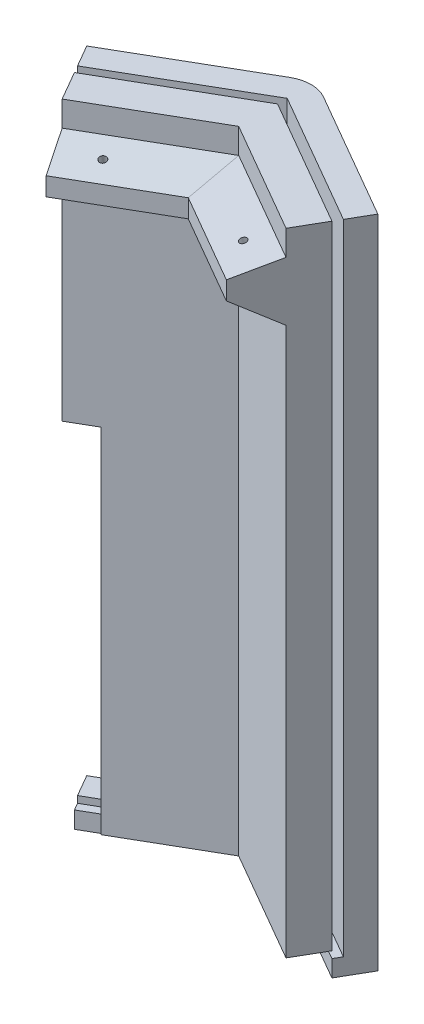
from build123d import *

# Parameters (mm, degrees)
BOSS_EXTRUDE1_DEPTH = 390
CUT_EXTRUDE2_DEPTH  = 14
CUT_EXTRUDE3_DEPTH  = 50
BOSS_EXTRUDE2_DEPTH = 10
BOSS_EXTRUDE3_REACH = 473.852
BOSS_EXTRUDE4_REACH = 479.913
SKETCH22_R          = 2.1
CUT_EXTRUDE4_DEPTH  = 15
SKETCH23_R          = 3.1
CUT_EXTRUDE5_DEPTH  = 60
SKETCH24_W          = 17
SKETCH24_H          = 210
CUT_EXTRUDE6_DEPTH  = 414.617211129


with BuildPart() as part:
    # Sketch1 → Boss-Extrude1 (new body)
    with BuildSketch(Plane(origin=(0, 0, 0), x_dir=(1, 0, 0), z_dir=(0, 1, 0))):
        with BuildLine():
            Line((-10, -5.773502692), (-86.602540378, -50))
            Line((-86.602540378, -50), (-79.102540378, -62.990381057))
            Line((-79.102540378, -62.990381057), (-53.121778265, -47.990381057))
            Line((-53.121778265, -47.990381057), (-50.621778265, -52.320508076))
            Line((-50.621778265, -52.320508076), (-76.602540378, -67.320508076))
            Line((-76.602540378, -67.320508076), (-66.602540378, -84.641016151))
            Line((-66.602540378, -84.641016151), (0, -46.188021535))
            Line((0, -46.188021535), (66.602540378, -84.641016151))
            Line((66.602540378, -84.641016151), (76.602540378, -67.320508076))
            Line((76.602540378, -67.320508076), (50.621778265, -52.320508076))
            Line((50.621778265, -52.320508076), (53.121778265, -47.990381057))
            Line((53.121778265, -47.990381057), (79.102540378, -62.990381057))
            Line((79.102540378, -62.990381057), (86.602540378, -50))
            Line((86.602540378, -50), (10, -5.773502692))
            ThreePointArc((10, -5.773502692), (0, -3.094010768), (-10, -5.773502692))
        make_face()
    extrude(amount=BOSS_EXTRUDE1_DEPTH)

    # Sketch18 → Cut-Extrude2 (cut)
    with BuildSketch(Plane.XZ):
        Polygon((-76.602540378, 67.320508076), (0, 23.094010768), (76.602540378, 67.320508076), (66.602540378, 84.641016151), (0, 46.188021535), (-66.602540378, 84.641016151), align=None)
    extrude(amount=-CUT_EXTRUDE2_DEPTH, mode=Mode.SUBTRACT)

    # Sketch19 → Cut-Extrude3 (cut)
    with BuildSketch(Plane(origin=(0, 390, 0), x_dir=(1, 0, 0), z_dir=(0, 1, 0))):
        Polygon((76.602540378, -67.320508076), (0, -23.094010768), (-76.602540378, -67.320508076), (-79.102540378, -62.990381057), (0, -17.320508076), (79.102540378, -62.990381057), align=None)
    extrude(amount=-CUT_EXTRUDE3_DEPTH, mode=Mode.SUBTRACT)

    # Sketch20 → Boss-Extrude2 (add)
    with BuildSketch(Plane.XZ):
        Polygon((76.602540378, 67.320508076), (50.621778265, 52.320508076), (53.121778265, 47.990381057), (79.102540378, 62.990381057), align=None)
        Polygon((-50.621778265, 52.320508076), (-76.602540378, 67.320508076), (-79.102540378, 62.990381057), (-53.121778265, 47.990381057), align=None)
    extrude(amount=-BOSS_EXTRUDE2_DEPTH)

    # Boss-Extrude3: up to this plane
    boss_extrude3_end = Plane(origin=(-86.602540378, 390, 50), z_dir=(0.8660254037844359, 0, -0.5000000000000048))
    # Sketch21 → Boss-Extrude3 (add, up to the surface)
    with BuildSketch(Plane(origin=(0, 0, 0), x_dir=(0, 0, -1), z_dir=(1, 0, 0)), mode=Mode.PRIVATE) as boss_extrude3_sk1:
        Polygon((-46.188021535, 375), (-76.188021535, 368.206188758), (-76.188021535, 357.320508076), (-46.188021535, 340), align=None)
    boss_extrude3_tool1 = split(extrude(boss_extrude3_sk1.sketch, amount=BOSS_EXTRUDE3_REACH, dir=(-0.866025403784, 0, 0.5), mode=Mode.PRIVATE), bisect_by=boss_extrude3_end, keep=Keep.BOTH, mode=Mode.PRIVATE)
    add(boss_extrude3_tool1.solids().sort_by_distance((0, 359.670666, 58.56037))[0])

    # Boss-Extrude4: up to this plane
    boss_extrude4_end = Plane(origin=(76.602540378, 390, 67.320508076), z_dir=(-0.8660254037844398, 0, -0.49999999999999795))
    # Sketch21<2> → Boss-Extrude4 (add, up to the surface)
    with BuildSketch(Plane(origin=(0, 0, 0), x_dir=(0, 0, -1), z_dir=(1, 0, 0)), mode=Mode.PRIVATE) as boss_extrude4_sk1:
        Polygon((-46.188021535, 375), (-76.188021535, 368.206188758), (-76.188021535, 357.320508076), (-46.188021535, 340), align=None)
    boss_extrude4_tool1 = split(extrude(boss_extrude4_sk1.sketch, amount=BOSS_EXTRUDE4_REACH, dir=(0.866025403784, 0, 0.5), mode=Mode.PRIVATE), bisect_by=boss_extrude4_end, keep=Keep.BOTH, mode=Mode.PRIVATE)
    add(boss_extrude4_tool1.solids().sort_by_distance((0, 359.670666, 58.56037))[0])

    # Sketch22 → Cut-Extrude4 (cut)
    with BuildSketch(Plane(origin=(47.172106066, 360.789319124, 81.704484407), x_dir=(0.9919674102096397, -0.12336978823439818, -0.027938368473838713), z_dir=(0.1264937037246528, 0.9674695714450556, 0.21909352168866242))):
        with Locations((-89.639756751, -1.109544744)):
            Circle(SKETCH22_R)
    cut_extrude4 = extrude(amount=-CUT_EXTRUDE4_DEPTH, mode=Mode.SUBTRACT)

    # Mirror1: Cut-Extrude4 across plane
    add(cut_extrude4.mirror(Plane(origin=(0, 0, 0), x_dir=(0, 0, 1), z_dir=(1, 0, 0))), mode=Mode.SUBTRACT)

    # Sketch23 → Cut-Extrude5 (cut)
    with BuildSketch(Plane.XZ.offset(-14)):
        with Locations((-25.980762114, 49.641016151)):
            Circle(SKETCH23_R)
        with Locations((-51.961524227, 64.641016151)):
            Circle(SKETCH23_R)
    cut_extrude5 = extrude(amount=-CUT_EXTRUDE5_DEPTH, mode=Mode.SUBTRACT)

    # Mirror2: Cut-Extrude5 across plane
    add(cut_extrude5.mirror(Plane(origin=(0, 0, 0), x_dir=(0, 0, 1), z_dir=(1, 0, 0))), mode=Mode.SUBTRACT)

    # Sketch24 → Cut-Extrude6 (cut, through all)
    with BuildSketch(Plane(origin=(0, 0, 0), x_dir=(-0.8660254037844378, 0, 0.5000000000000017), z_dir=(-0.5000000000000016, 0, -0.8660254037844377))):
        with Locations((91.5, 119)):
            Rectangle(SKETCH24_W, SKETCH24_H)
    extrude(amount=-CUT_EXTRUDE6_DEPTH, mode=Mode.SUBTRACT)


solid = part.part
